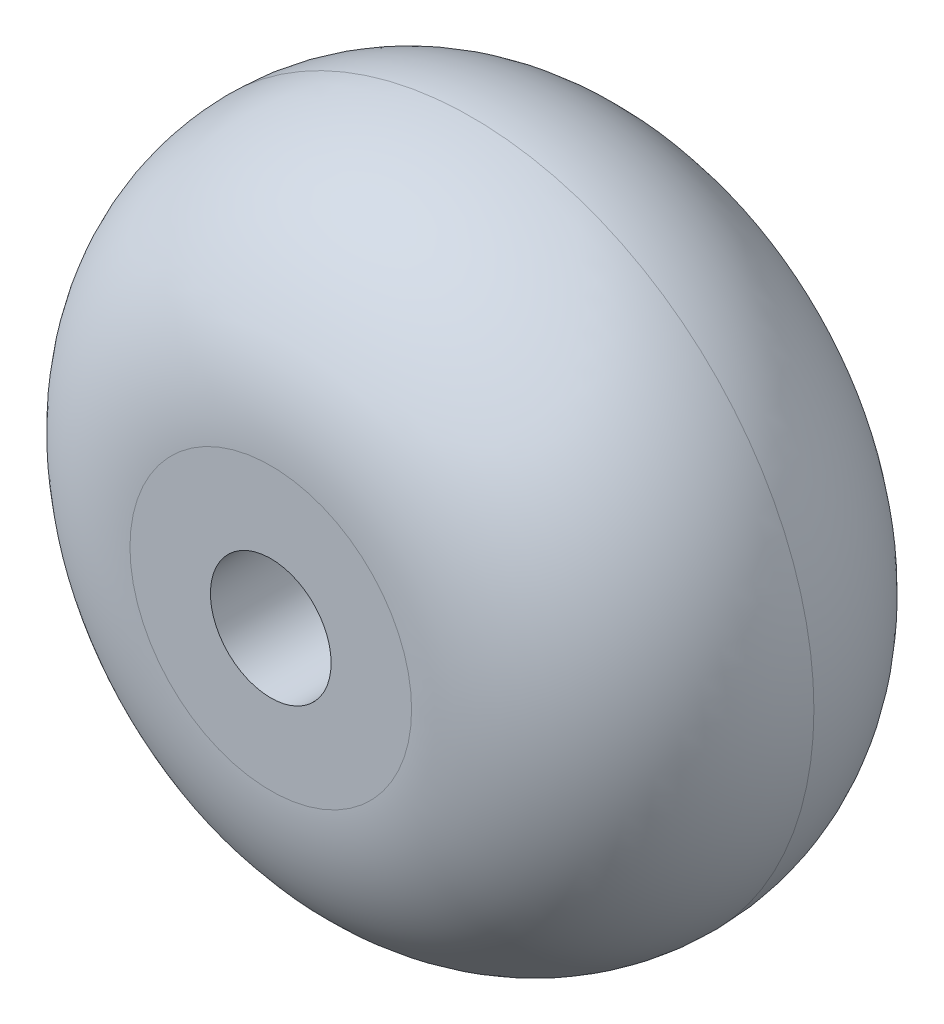
from build123d import *

# Parameters (mm, degrees)
ESBO_O1_R                = 17
ESBO_O1_R_2              = 3
RESSALTO_EXTRUS_O1_DEPTH = 20
FILETE1_R                = 10


with BuildPart() as part:
    # Esboço1 → Ressalto-extrusão1 (new body)
    with BuildSketch(Plane.XY):
        Circle(ESBO_O1_R)
        Circle(ESBO_O1_R_2, mode=Mode.SUBTRACT)
    extrude(amount=RESSALTO_EXTRUS_O1_DEPTH)

    # Filete1
    filete1_edges = [part.edges().sort_by_distance(p)[0] for p in [
        (-17, 0, 0),
        (-17, 0, 20),
    ]]
    fillet(filete1_edges, radius=FILETE1_R - 0.0001)  # a hair under: the kernel refuses the full size


solid = part.part
